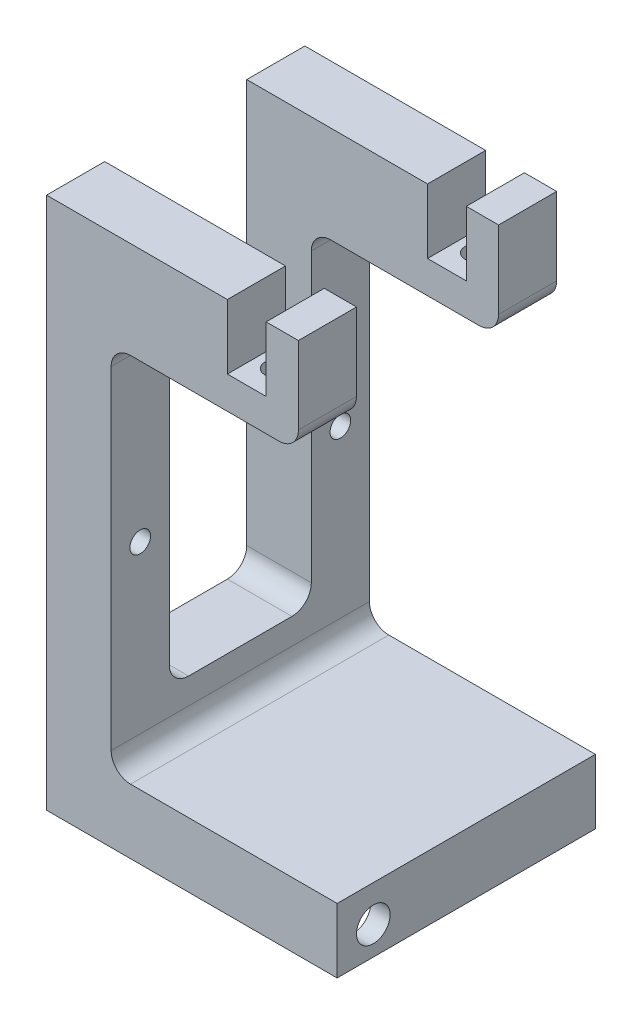
from build123d import *

# Parameters (mm, degrees)
BOSS_EXTRUDE1_DEPTH = 40
SKETCH2_W           = 22
SKETCH2_H           = 65.5
CUT_EXTRUDE1_DEPTH  = 103.133491079
CUT_EXTRUDE2_REACH  = 96.24
SKETCH4_R           = 1.7
SKETCH7_R           = 2.6
CUT_EXTRUDE3_DEPTH  = 10
FILLET1_R           = 3
FILLET2_R           = 3
SKETCH8_W           = 39
SKETCH8_H           = 34
CUT_EXTRUDE4_DEPTH  = 7
CUT_EXTRUDE5_REACH  = 100.139
SKETCH9_R           = 1.6


with BuildPart() as part:
    # Sketch1 → Boss-Extrude1 (new body)
    with BuildSketch(Plane.XY):
        Polygon((10, 10), (45, 10), (45, 0), (0, 0), (0, 82.5), (28, 82.5), (28, 72.5), (34, 72.5), (34, 82.5), (39, 82.5), (39, 67.5), (10, 67.5), align=None)
    extrude(amount=BOSS_EXTRUDE1_DEPTH)

    # Sketch2 → Cut-Extrude1 (cut, through all)
    with BuildSketch(Plane.ZY):
        with Locations((20, 49.75)):
            Rectangle(SKETCH2_W, SKETCH2_H)
    extrude(amount=-CUT_EXTRUDE1_DEPTH, mode=Mode.SUBTRACT)

    # Sketch4 → Cut-Extrude2 (cut, up to next)
    with BuildSketch(Plane(origin=(0, 72.5, 0), x_dir=(1, 0, 0), z_dir=(0, 1, 0)), mode=Mode.PRIVATE) as cut_extrude2_sk1:
        with Locations((31, -35.5)):
            Circle(SKETCH4_R)
    cut_extrude2_tool1 = extrude(cut_extrude2_sk1.sketch, amount=-CUT_EXTRUDE2_REACH, mode=Mode.PRIVATE) & part.part
    # Sketch4 → Cut-Extrude2 (cut, up to next)
    with BuildSketch(Plane(origin=(0, 72.5, 0), x_dir=(1, 0, 0), z_dir=(0, 1, 0)), mode=Mode.PRIVATE) as cut_extrude2_sk2:
        with Locations((31, -4.5)):
            Circle(SKETCH4_R)
    cut_extrude2_tool2 = extrude(cut_extrude2_sk2.sketch, amount=-CUT_EXTRUDE2_REACH, mode=Mode.PRIVATE) & part.part
    add(cut_extrude2_tool1.solids().sort_by_distance((31, 72.5, 35.5))[0], mode=Mode.SUBTRACT)
    add(cut_extrude2_tool2.solids().sort_by_distance((31, 72.5, 4.5))[0], mode=Mode.SUBTRACT)

    # Sketch7 → Cut-Extrude3 (cut)
    with BuildSketch(Plane(origin=(45, 0, 0), x_dir=(0, 0, -1), z_dir=(1, 0, 0))):
        with Locations((-34.4, 4.4)):
            Circle(SKETCH7_R)
    extrude(amount=-CUT_EXTRUDE3_DEPTH, mode=Mode.SUBTRACT)

    # Fillet1
    fillet1_edges = [part.edges().sort_by_distance(p)[0] for p in [
        (10, 10, 20),
        (5, 17, 31),
        (5, 17, 9),
    ]]
    fillet(fillet1_edges, radius=FILLET1_R)

    # Fillet2
    fillet2_edges = [part.edges().sort_by_distance(p)[0] for p in [
        (39, 67.5, 4.5),
        (39, 67.5, 35.5),
        (10, 67.5, 35.5),
        (10, 67.5, 4.5),
    ]]
    fillet(fillet2_edges, radius=FILLET2_R)

    # Sketch8 → Cut-Extrude4 (cut)
    with BuildSketch(Plane.XZ):
        with Locations((22.5, 20)):
            Rectangle(SKETCH8_W, SKETCH8_H)
    extrude(amount=-CUT_EXTRUDE4_DEPTH, mode=Mode.SUBTRACT)

    # Sketch9 → Cut-Extrude5 (cut, up to next)
    with BuildSketch(Plane(origin=(10, 0, 0), x_dir=(0, 0, -1), z_dir=(1, 0, 0)), mode=Mode.PRIVATE) as cut_extrude5_sk1:
        with Locations((-4.5, 38.75)):
            Circle(SKETCH9_R)
    cut_extrude5_tool1 = extrude(cut_extrude5_sk1.sketch, amount=-CUT_EXTRUDE5_REACH, mode=Mode.PRIVATE) & part.part
    # Sketch9 → Cut-Extrude5 (cut, up to next)
    with BuildSketch(Plane(origin=(10, 0, 0), x_dir=(0, 0, -1), z_dir=(1, 0, 0)), mode=Mode.PRIVATE) as cut_extrude5_sk2:
        with Locations((-35.5, 38.75)):
            Circle(SKETCH9_R)
    cut_extrude5_tool2 = extrude(cut_extrude5_sk2.sketch, amount=-CUT_EXTRUDE5_REACH, mode=Mode.PRIVATE) & part.part
    add(cut_extrude5_tool1.solids().sort_by_distance((10, 38.75, 4.5))[0], mode=Mode.SUBTRACT)
    add(cut_extrude5_tool2.solids().sort_by_distance((10, 38.75, 35.5))[0], mode=Mode.SUBTRACT)


solid = part.part
